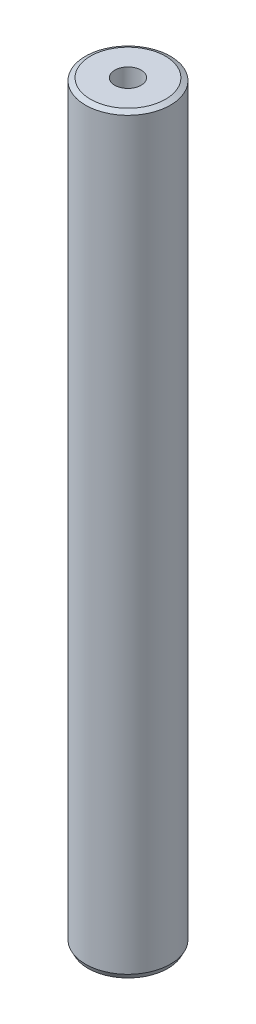
from build123d import *
from OCP.BRepFilletAPI import BRepFilletAPI_MakeChamfer

# Parameters (mm, degrees)
SKETCH1_R           = 5
BOSS_EXTRUDE1_DEPTH = 88.491303668
SKETCH2_R           = 1.552006397
CUT_EXTRUDE1_DEPTH  = 89.773367768
CHAMFER1_SIZE       = 0.301947842
CHAMFER1_SIZE2      = 0.590605177


with BuildPart() as part:
    # Sketch1 → Boss-Extrude1 (new body)
    with BuildSketch(Plane(origin=(0, 0, 0), x_dir=(1, 0, 0), z_dir=(0, 1, 0))):
        Circle(SKETCH1_R)
    extrude(amount=BOSS_EXTRUDE1_DEPTH)

    # Sketch2 → Cut-Extrude1 (cut, through all)
    with BuildSketch(Plane(origin=(0, 0, 0), x_dir=(1, 0, 0), z_dir=(0, 1, 0))):
        Circle(SKETCH2_R)
    extrude(amount=CUT_EXTRUDE1_DEPTH, mode=Mode.SUBTRACT)

    # Chamfer1: one chamfer whose edges measure the first distance from different faces: ONE call of the kernel's chamfer builder (chamfer() names one face for all edges)
    chamfer1_edges_1 = [part.edges().sort_by_distance(p)[0] for p in [
        (-5, 88.491303668, 0),
    ]]
    chamfer1_side_1 = [part.faces().sort_by_distance(p)[0] for p in [
        (-5, 44.245651834, 0),
    ]]
    chamfer1_edges_2 = [part.edges().sort_by_distance(p)[0] for p in [
        (-5, 0, 0),
    ]]
    chamfer1_side_2 = [part.faces().sort_by_distance(p)[0] for p in [
        (-4.858578644, 0, 0),
    ]]
    chamfer1 = BRepFilletAPI_MakeChamfer(part.part.solid().wrapped)
    for e in chamfer1_edges_1:
        chamfer1.Add(CHAMFER1_SIZE, CHAMFER1_SIZE2, e.wrapped, chamfer1_side_1[0].wrapped)  # the first distance lies on this face
    for e in chamfer1_edges_2:
        chamfer1.Add(CHAMFER1_SIZE, CHAMFER1_SIZE2, e.wrapped, chamfer1_side_2[0].wrapped)  # the first distance lies on this face
    add(Compound.cast(chamfer1.Shape()), mode=Mode.REPLACE)


solid = part.part
